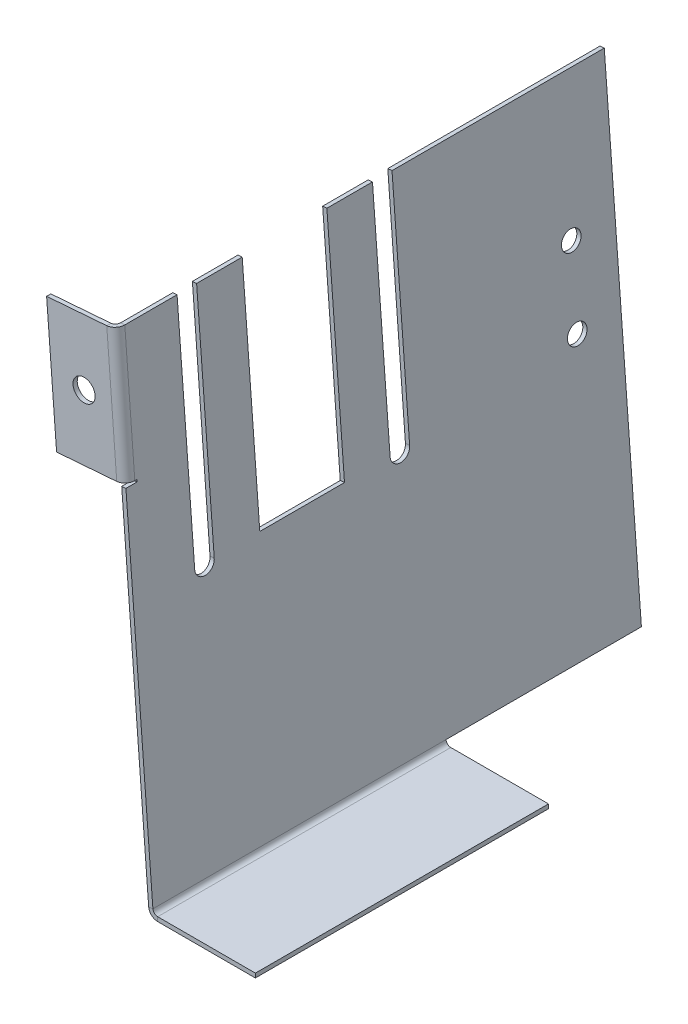
from build123d import *

# Parameters (mm, degrees)
VERTICAL_WALL_DEPTH           = 0.65
SMALL_END_ARM_DEPTH           = 75
SKETCH10_W                    = 13
SKETCH10_H                    = 35.229215797
SMALL_END_SLOTS_DEPTH         = 0.65
EDGE_FLANGE4_STRIP_W          = 4.0732
EDGE_FLANGE4_STRIP_H          = 0.65
EDGE_FLANGE4_STRIP_CUT_DEPTH  = 20
EDGE_FLANGE4_RELIEF_W         = 4.3982
EDGE_FLANGE4_RELIEF_H         = 0.325
EDGE_FLANGE4_RELIEF_CUT_DEPTH = 0.65
EDGE_FLANGE4_DEPTH            = 20
SKETCH28_R                    = 1.5
GUARD_MOUNTING_HOLES_2_DEPTH  = 0.65
CUT_EXTRUDE1_START            = -80
CUT_EXTRUDE1_DEPTH            = 35
M3_CLEARANCE_HOLE1_D          = 3.4
M3_CLEARANCE_HOLE1_DEPTH      = 10
M3_CLEARANCE_HOLE1_TIP        = 1.021463052


# Read off the part's stored shape, not the designer's step: Cut-Extrude1
# Sheet-metal steps are written as plain solids
with BuildPart() as part:
    # Sketch1 → Vertical Wall (new body)
    with BuildSketch(Plane(origin=(0, 0, 0), x_dir=(1, 0, 0), z_dir=(0, 1, 0))):
        Polygon((0, 0), (15, 0), (15, 80), (0.01, 75.000714286), (0, 75), align=None)
    extrude(amount=-VERTICAL_WALL_DEPTH)

    # Small End Arm section (across the edge) → Small End Arm (add)
    with BuildSketch(Plane(origin=(-0.682114537, 0, -75), x_dir=(0.9970544854948823, 0.07669649897182769, 0), z_dir=(0, 0, 1))):
        with BuildLine():
            Line((-0.65, 0.682114537), (-0.65, 75))
            Line((-0.65, 75), (0, 75))
            Line((0, 75), (0, 0.682114537))
            ThreePointArc((0, 0.682114537), (0.196140236, 0.181631966), (0.680105359, -0.052315797))
            Line((0.680105359, -0.052315797), (0.630252635, -0.700401212))
            ThreePointArc((0.630252635, -0.700401212), (-0.280779186, -0.26001027), (-0.65, 0.682114537))
        make_face()
    extrude(amount=SMALL_END_ARM_DEPTH)

    # Sketch10 → Small End Slots (cut)
    with BuildSketch(Plane(origin=(-1.326187514, -0.102014424, 0), x_dir=(0, 0, 1), z_dir=(-0.9970544854948824, -0.07669649897182769, 0))):
        with Locations((-25.9123, 57.437707899)):
            Rectangle(SKETCH10_W, SKETCH10_H)
        with BuildLine():
            Line((-39.4123, 75.052315797), (-39.4123, 39.770784203))
            ThreePointArc((-39.4123, 39.770784203), (-40.9123, 38.270784203), (-42.4123, 39.770784203))
            Line((-42.4123, 39.770784203), (-42.4123, 75.052315797))
            ThreePointArc((-42.4123, 75.052315797), (-40.9123, 76.552315797), (-39.4123, 75.052315797))
        make_face()
        with BuildLine():
            Line((-9.4123, 75.052315797), (-9.4123, 39.770784203))
            ThreePointArc((-9.4123, 39.770784203), (-10.9123, 38.270784203), (-12.4123, 39.770784203))
            Line((-12.4123, 39.770784203), (-12.4123, 75.052315797))
            ThreePointArc((-12.4123, 75.052315797), (-10.9123, 76.552315797), (-9.4123, 75.052315797))
        make_face()
    extrude(amount=-SMALL_END_SLOTS_DEPTH, mode=Mode.SUBTRACT)

    # Edge-Flange4 strip (across the edge) → Edge-Flange4 strip cut (cut)
    with BuildSketch(Plane(origin=(-5.548507396, 54.788143978, 0), x_dir=(0, 0, -1), z_dir=(-0.0766964989718277, 0.9970544854948823, 0))):
        with Locations((-0.65, -0.325)):
            Rectangle(EDGE_FLANGE4_STRIP_W, EDGE_FLANGE4_STRIP_H)
    extrude(amount=EDGE_FLANGE4_STRIP_CUT_DEPTH, mode=Mode.SUBTRACT)

    # Edge-Flange4 relief (on the sheet) → Edge-Flange4 relief cut (cut)
    with BuildSketch(Plane(origin=(-5.548507396, 54.788143978, -1.3866), x_dir=(0, 0, -1), z_dir=(-0.9970544854948823, -0.0766964989718277, 6.982374222178593e-15))):
        with Locations((-1.8741, 0.1625)):
            Rectangle(EDGE_FLANGE4_RELIEF_W, EDGE_FLANGE4_RELIEF_H)
    extrude(amount=-EDGE_FLANGE4_RELIEF_CUT_DEPTH, mode=Mode.SUBTRACT)

    # Edge-Flange4 section (across the edge) → Edge-Flange4 (add)
    with BuildSketch(Plane(origin=(-5.548507396, 54.788143978, 0), x_dir=(0, 0, -1), z_dir=(-0.0766964989718277, 0.9970544854948823, 0))):
        with BuildLine():
            Line((0, 0.7366), (0, 10))
            Line((0, 10), (0.65, 10))
            Line((0.65, 10), (0.65, 0.7366))
            ThreePointArc((0.65, 0.7366), (0.865745145, 0.215745145), (1.3866, 0))
            Line((1.3866, 0), (1.3866, -0.65))
            ThreePointArc((1.3866, -0.65), (0.406125737, -0.243874263), (0, 0.7366))
        make_face()
    extrude(amount=EDGE_FLANGE4_DEPTH)

    # Sketch28 → Guard Mounting Holes 2 (cut)
    with BuildSketch(Plane(origin=(-1.326187514, -0.102014424, 0), x_dir=(0, 0, 1), z_dir=(-0.9970544854948823, -0.07669649897182768, 0))):
        with Locations(Location((-68.282596145, 53.577296087, 0), (0, 0, 270))):
            Circle(SKETCH28_R)
        with Locations(Location((-68.282596145, 41.577296087, 0), (0, 0, 270))):
            Circle(SKETCH28_R)
    extrude(amount=-GUARD_MOUNTING_HOLES_2_DEPTH, mode=Mode.SUBTRACT)

    # Cut-Extrude1 outline → Cut-Extrude1 (cut)
    with BuildSketch(Plane.XY.offset(CUT_EXTRUDE1_START)):
        with BuildLine():
            Line((-0.734430334, 0.680105359), (-1.38251575, 0.630252635))
            ThreePointArc((-1.38251575, 0.630252635), (-0.942124807, -0.280779186), (0, -0.65))
            Line((0, -0.65), (15, -0.65))
            Line((15, -0.65), (15, 0))
            Line((15, 0), (0, 0))
            ThreePointArc((0, 0), (-0.500482571, 0.196140236), (-0.734430334, 0.680105359))
        make_face()
    extrude(amount=CUT_EXTRUDE1_DEPTH, mode=Mode.SUBTRACT)

    # M3 Clearance Hole1
    with Locations(Plane(origin=(0, 0, -0.65), x_dir=(-1, 0, 0), z_dir=(0, 0, -1))):
        with Locations((11.300744813, 64.375206338)):
            Hole(M3_CLEARANCE_HOLE1_D / 2, depth=M3_CLEARANCE_HOLE1_DEPTH)
            with Locations((0, 0, -(M3_CLEARANCE_HOLE1_DEPTH + M3_CLEARANCE_HOLE1_TIP / 2))):  # 118° drill point
                Cone(0, M3_CLEARANCE_HOLE1_D / 2, M3_CLEARANCE_HOLE1_TIP, mode=Mode.SUBTRACT)


solid = part.part
